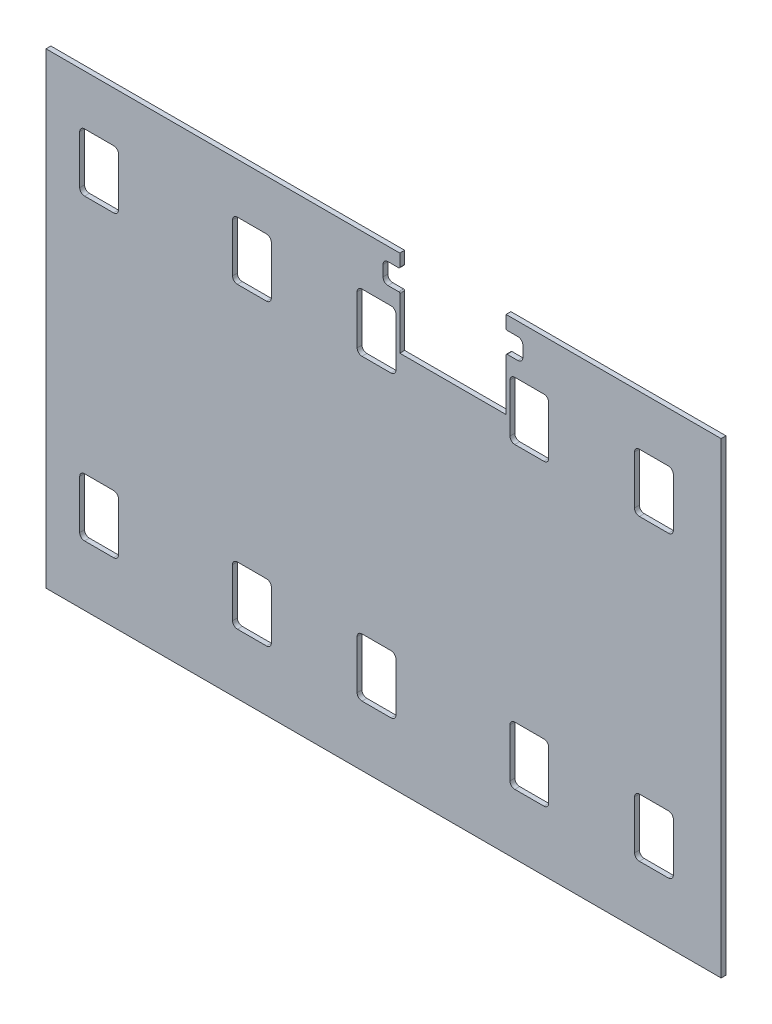
from build123d import *

# Parameters (mm, degrees)
SKETCH1_W           = 441.979400076
SKETCH1_H           = 305.81676
BOSS_EXTRUDE1_DEPTH = 3.175
CUT_EXTRUDE1_DEPTH  = 271.654843319
CUT_EXTRUDE2_DEPTH  = 271.654843319
LPATTERN1_COUNT     = 3
LPATTERN1_PITCH     = 181.613999992
LPATTERN2_COUNT     = 2
LPATTERN2_PITCH     = 181.613999992
CUT_EXTRUDE3_DEPTH  = 271.654843319


with BuildPart() as part:
    # Sketch1 → Boss-Extrude1 (new body)
    with BuildSketch(Plane.XY):
        with Locations((0, -3.32067)):
            Rectangle(SKETCH1_W, SKETCH1_H)
    extrude(amount=BOSS_EXTRUDE1_DEPTH)

    # Sketch2 → Cut-Extrude1 (cut, through all)
    with BuildSketch(Plane.XY.offset(3.175)):
        with BuildLine():
            Line((-176.7105, 116.8), (-195.7605, 116.8))
            ThreePointArc((-195.7605, 116.8), (-198.00556403, 115.87006403), (-198.9355, 113.625))
            Line((-198.9355, 113.625), (-198.9355, 81.875))
            ThreePointArc((-198.9355, 81.875), (-198.00556403, 79.62993597), (-195.7605, 78.7))
            Line((-195.7605, 78.7), (-176.7105, 78.7))
            ThreePointArc((-176.7105, 78.7), (-174.46543597, 79.62993597), (-173.5355, 81.875))
            Line((-173.5355, 81.875), (-173.5355, 113.625))
            ThreePointArc((-173.5355, 113.625), (-174.46543597, 115.87006403), (-176.7105, 116.8))
        make_face()
        with BuildLine():
            Line((-176.7105, -78.7), (-195.7605, -78.7))
            ThreePointArc((-195.7605, -78.7), (-198.00556403, -79.62993597), (-198.9355, -81.875))
            Line((-198.9355, -81.875), (-198.9355, -113.625))
            ThreePointArc((-198.9355, -113.625), (-198.00556403, -115.87006403), (-195.7605, -116.8))
            Line((-195.7605, -116.8), (-176.7105, -116.8))
            ThreePointArc((-176.7105, -116.8), (-174.46543597, -115.87006403), (-173.5355, -113.625))
            Line((-173.5355, -113.625), (-173.5355, -81.875))
            ThreePointArc((-173.5355, -81.875), (-174.46543597, -79.62993597), (-176.7105, -78.7))
        make_face()
    cut_extrude1 = extrude(amount=-CUT_EXTRUDE1_DEPTH, mode=Mode.SUBTRACT)

    # Sketch3 → Cut-Extrude2 (cut, through all)
    with BuildSketch(Plane.XY.offset(3.175)):
        with BuildLine():
            ThreePointArc((-73.4905, 113.625), (-74.42043597, 115.87006403), (-76.6655, 116.8))
            Line((-76.6655, 116.8), (-95.7155, 116.8))
            ThreePointArc((-95.7155, 116.8), (-97.96056403, 115.87006403), (-98.8905, 113.625))
            Line((-98.8905, 113.625), (-98.8905, 81.875))
            ThreePointArc((-98.8905, 81.875), (-97.96056403, 79.62993597), (-95.7155, 78.7))
            Line((-95.7155, 78.7), (-76.6655, 78.7))
            ThreePointArc((-76.6655, 78.7), (-74.42043597, 79.62993597), (-73.4905, 81.875))
            Line((-73.4905, 81.875), (-73.4905, 113.625))
        make_face()
        with BuildLine():
            ThreePointArc((-98.8905, -113.625), (-97.96056403, -115.87006403), (-95.7155, -116.8))
            Line((-95.7155, -116.8), (-76.6655, -116.8))
            ThreePointArc((-76.6655, -116.8), (-74.42043597, -115.87006403), (-73.4905, -113.625))
            Line((-73.4905, -113.625), (-73.4905, -81.875))
            ThreePointArc((-73.4905, -81.875), (-74.42043597, -79.62993597), (-76.6655, -78.7))
            Line((-76.6655, -78.7), (-95.7155, -78.7))
            ThreePointArc((-95.7155, -78.7), (-97.96056403, -79.62993597), (-98.8905, -81.875))
            Line((-98.8905, -81.875), (-98.8905, -113.625))
        make_face()
    cut_extrude2 = extrude(amount=-CUT_EXTRUDE2_DEPTH, mode=Mode.SUBTRACT)

    # LPattern1: Cut-Extrude1 ×3
    with Locations(*[(i * LPATTERN1_PITCH, 0, 0) for i in range(1, LPATTERN1_COUNT)]):
        add(cut_extrude1, mode=Mode.SUBTRACT)

    # LPattern2: Cut-Extrude2 ×2
    with Locations(*[(i * LPATTERN2_PITCH, 0, 0) for i in range(1, LPATTERN2_COUNT)]):
        add(cut_extrude2, mode=Mode.SUBTRACT)

    # Sketch4 → Cut-Extrude3 (cut, through all)
    with BuildSketch(Plane.XY.offset(3.175)):
        with BuildLine():
            ThreePointArc((9.900999992, 127.31771), (10.417187942, 127.10389795), (10.630999992, 126.58771))
            Line((10.630999992, 126.58771), (10.630999992, 92.81771))
            Line((10.630999992, 92.81771), (80.170999992, 92.81771))
            Line((80.170999992, 92.81771), (80.170999992, 126.58771))
            ThreePointArc((80.170999992, 126.58771), (80.384812042, 127.10389795), (80.900999992, 127.31771))
            Line((80.900999992, 127.31771), (87.900999992, 127.31771))
            ThreePointArc((87.900999992, 127.31771), (90.213239166, 128.275470826), (91.170999992, 130.58771))
            Line((91.170999992, 130.58771), (91.170999992, 137.58771))
            ThreePointArc((91.170999992, 137.58771), (90.213239166, 139.899949174), (87.900999992, 140.85771))
            Line((87.900999992, 140.85771), (80.900999992, 140.85771))
            ThreePointArc((80.900999992, 140.85771), (80.384812042, 141.07152205), (80.170999992, 141.58771))
            Line((80.170999992, 141.58771), (80.170999992, 149.58771))
            Line((80.170999992, 149.58771), (10.630999992, 149.58771))
            Line((10.630999992, 149.58771), (10.630999992, 141.58771))
            ThreePointArc((10.630999992, 141.58771), (10.417187942, 141.07152205), (9.900999992, 140.85771))
            Line((9.900999992, 140.85771), (2.900999992, 140.85771))
            ThreePointArc((2.900999992, 140.85771), (0.588760818, 139.899949174), (-0.369000008, 137.58771))
            Line((-0.369000008, 137.58771), (-0.369000008, 130.58771))
            ThreePointArc((-0.369000008, 130.58771), (0.588760818, 128.275470826), (2.900999992, 127.31771))
            Line((2.900999992, 127.31771), (9.900999992, 127.31771))
        make_face()
        with BuildLine():
            Line((2.900999992, 139.58771), (9.900999992, 139.58771))
            ThreePointArc((9.900999992, 139.58771), (11.315213554, 140.173496438), (11.900999992, 141.58771))
            Line((11.900999992, 141.58771), (11.900999992, 126.58771))
            ThreePointArc((11.900999992, 126.58771), (11.315213554, 128.001923562), (9.900999992, 128.58771))
            Line((9.900999992, 128.58771), (2.900999992, 128.58771))
            ThreePointArc((2.900999992, 128.58771), (1.48678643, 129.173496438), (0.900999992, 130.58771))
            Line((0.900999992, 130.58771), (0.900999992, 137.58771))
            ThreePointArc((0.900999992, 137.58771), (1.48678643, 139.001923562), (2.900999992, 139.58771))
        make_face(mode=Mode.SUBTRACT)
        with BuildLine():
            ThreePointArc((78.900999992, 141.58771), (79.48678643, 140.173496438), (80.900999992, 139.58771))
            Line((80.900999992, 139.58771), (87.900999992, 139.58771))
            ThreePointArc((87.900999992, 139.58771), (89.315213554, 139.001923562), (89.900999992, 137.58771))
            Line((89.900999992, 137.58771), (89.900999992, 130.58771))
            ThreePointArc((89.900999992, 130.58771), (89.315213554, 129.173496438), (87.900999992, 128.58771))
            Line((87.900999992, 128.58771), (80.900999992, 128.58771))
            ThreePointArc((80.900999992, 128.58771), (79.48678643, 128.001923562), (78.900999992, 126.58771))
            Line((78.900999992, 126.58771), (78.900999992, 141.58771))
        make_face(mode=Mode.SUBTRACT)
    extrude(amount=-CUT_EXTRUDE3_DEPTH, mode=Mode.SUBTRACT)


with BuildPart() as cut_extrude3_kept_piece:
    # of the separate pieces the step leaves, the one the design keeps (cut_extrude3_pieces_kept)
    add(part.part.solids().sort_by_distance((220.989700038, 149.58771, 0))[0])


solid = cut_extrude3_kept_piece.part
